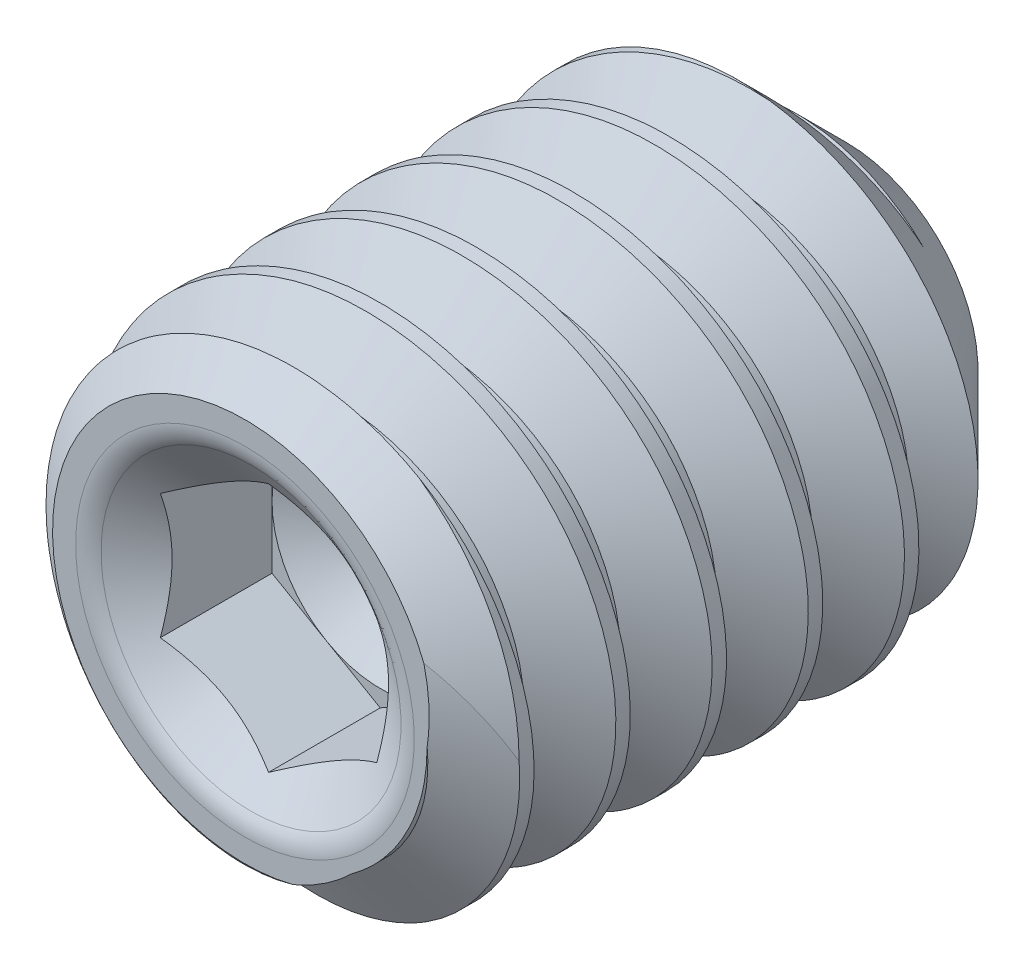
from build123d import *

# Parameters (mm, degrees)
CUT_SWEEP2_PITCH    = 0.4
CUT_EXTRUDE10_DEPTH = 0.5625
FILLET2_R           = 0.140192379


with BuildPart() as part:
    # Sketch22 → Revolve1 (revolve)
    with BuildSketch(Plane(origin=(0, 0, 0), x_dir=(0, 0, -1), z_dir=(1, 0, 0)), mode=Mode.PRIVATE) as revolve1_sk:
        Polygon((-1.085374734, 0), (-1.085374734, 0.8), (-0.945333226, 1), (0.962590173, 1), (1.414625266, 0.547964906), (1.085374734, 0), align=None)
    revolve(revolve1_sk.sketch.rotate(Axis((0, 0, -1.085374734), (0, 0, -1)), 180), axis=Axis((0, 0, -1.085374734), (0, 0, -1)))

    # Cut-Sweep2: the profile of Sketch28 profile screwed along a right-hand helix of 7.25 turns, 6 arcs to a turn; built about Z, then put on its axis
    cut_sweep2_z = Axis((0, 0, 0), (0, 0, 1))
    cut_sweep2_corners = [(1.0003, 0, 0.000173205), (1.0003, 0, -0.340173205), (0.757512887, 0, -0.2), (0.757512887, 0, -0.14)]
    with BuildLine(mode=Mode.PRIVATE) as cut_sweep2_profile:
        Line(cut_sweep2_corners[0], cut_sweep2_corners[1])
        Line(cut_sweep2_corners[1], cut_sweep2_corners[2])
        Line(cut_sweep2_corners[2], cut_sweep2_corners[3])
        Line(cut_sweep2_corners[3], cut_sweep2_corners[0])
    cut_sweep2_cap = Face(cut_sweep2_profile.wire())
    cut_sweep2_turn_angles = [0, 30, 60, 90, 120, 150, 180, 210, 240, 270, 300, 330, 360]
    cut_sweep2_turn_weights = [1, 0.8660254037844387, 1, 0.8660254037844387, 1, 0.8660254037844387, 1, 0.8660254037844387, 1, 0.8660254037844387, 1, 0.8660254037844387, 1]
    cut_sweep2_turn_rails = [Edge.make_bspline([Vector(p[0], p[1], 0).rotate(cut_sweep2_z, cut_sweep2_turn_angles[k]) / cut_sweep2_turn_weights[k] + Vector(0, 0, p[2] + CUT_SWEEP2_PITCH * cut_sweep2_turn_angles[k] / 360) for k in range(13)], [0, 0, 0, 1, 1, 2, 2, 3, 3, 4, 4, 5, 5, 6, 6, 6], 2, cut_sweep2_turn_weights) for p in cut_sweep2_corners]
    cut_sweep2_turn_sides = [Face.make_surface_from_curves(cut_sweep2_turn_rails[p[0]], cut_sweep2_turn_rails[p[1]]) for p in [(0, 1), (1, 2), (2, 3), (3, 0)]]
    cut_sweep2_last_angles = [2520, 2550, 2580, 2595, 2610]
    cut_sweep2_last_weights = [1, 0.8660254037844387, 1, 0.9659258262890529, 1]
    cut_sweep2_last_rails = [Edge.make_bspline([Vector(p[0], p[1], 0).rotate(cut_sweep2_z, cut_sweep2_last_angles[k]) / cut_sweep2_last_weights[k] + Vector(0, 0, p[2] + CUT_SWEEP2_PITCH * cut_sweep2_last_angles[k] / 360) for k in range(5)], [0, 0, 0, 1, 1, 2, 2, 2], 2, cut_sweep2_last_weights) for p in cut_sweep2_corners]
    cut_sweep2_last_sides = [Face.make_surface_from_curves(cut_sweep2_last_rails[p[0]], cut_sweep2_last_rails[p[1]]) for p in [(0, 1), (1, 2), (2, 3), (3, 0)]]
    cut_sweep2 = Plane(origin=(0, 0, -1.414625266), x_dir=(0, 1, 0), z_dir=(0, 0, 1)) * Solid(Shell([*[p.moved(Location((0, 0, CUT_SWEEP2_PITCH * i))) for i in range(7) for p in cut_sweep2_turn_sides], *cut_sweep2_last_sides, cut_sweep2_cap, cut_sweep2_cap.rotate(cut_sweep2_z, 2610).moved(Location((0, 0, CUT_SWEEP2_PITCH * 2610 / 360)))]))
    add(cut_sweep2, mode=Mode.SUBTRACT)

    # Sketch23 → Cut-Extrude10 (cut)
    with BuildSketch(Plane.XY.offset(1.085374734)):
        Polygon((0, 0.519615242), (-0.45, 0.259807621), (-0.45, -0.259807621), (0, -0.519615242), (0.45, -0.259807621), (0.45, 0.259807621), align=None)
    extrude(amount=-CUT_EXTRUDE10_DEPTH, mode=Mode.SUBTRACT)

    # Cut-Extrude11 cone 1 section (through the dimple's axis) → Cut-Extrude11 (revolve, cut)
    with BuildSketch(Plane(origin=(0, 0, 1.085374734), x_dir=(0, -1, 0), z_dir=(1, 0, 0))):
        Polygon((0, 0), (0.659807621, 0), (0, 0.46200227), align=None)
    revolve(axis=Axis((0, 0, 1.085374734), (0, 0, -1)), mode=Mode.SUBTRACT)

    # Cut-Extrude12 cone 1 section (through the dimple's axis) → Cut-Extrude12 (revolve, cut)
    with BuildSketch(Plane(origin=(0, 0, 0.522874734), x_dir=(0, -1, 0), z_dir=(1, 0, 0))):
        Polygon((0, 0), (0.45, 0), (0, 0.259807621), align=None)
    revolve(axis=Axis((0, 0, 0.522874734), (0, 0, -1)), mode=Mode.SUBTRACT)

    # Fillet2
    fillet2_edges = [part.edges().sort_by_distance(p)[0] for p in [
        (0, 0.659807621, 1.085374734),
    ]]
    fillet(fillet2_edges, radius=FILLET2_R)


solid = part.part
